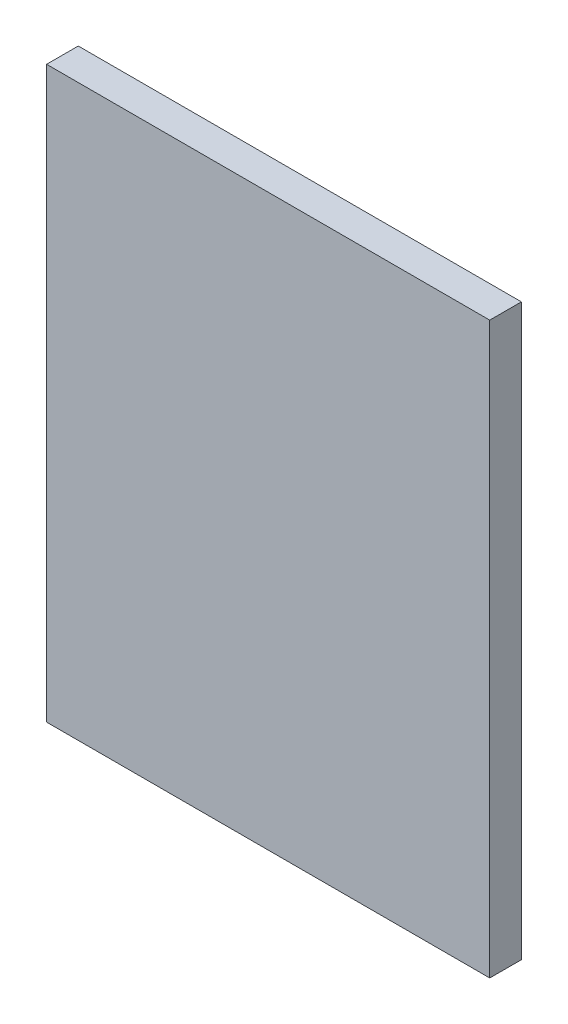
from build123d import *

# Parameters (mm, degrees)
SKETCH1_W           = 70
SKETCH1_H           = 90
BOSS_EXTRUDE1_DEPTH = 2.5


with BuildPart() as part:
    # Sketch1 → Boss-Extrude1 (new, symmetric)
    with BuildSketch(Plane.XY):
        Rectangle(SKETCH1_W, SKETCH1_H)
    extrude(amount=BOSS_EXTRUDE1_DEPTH, both=True)


solid = part.part
